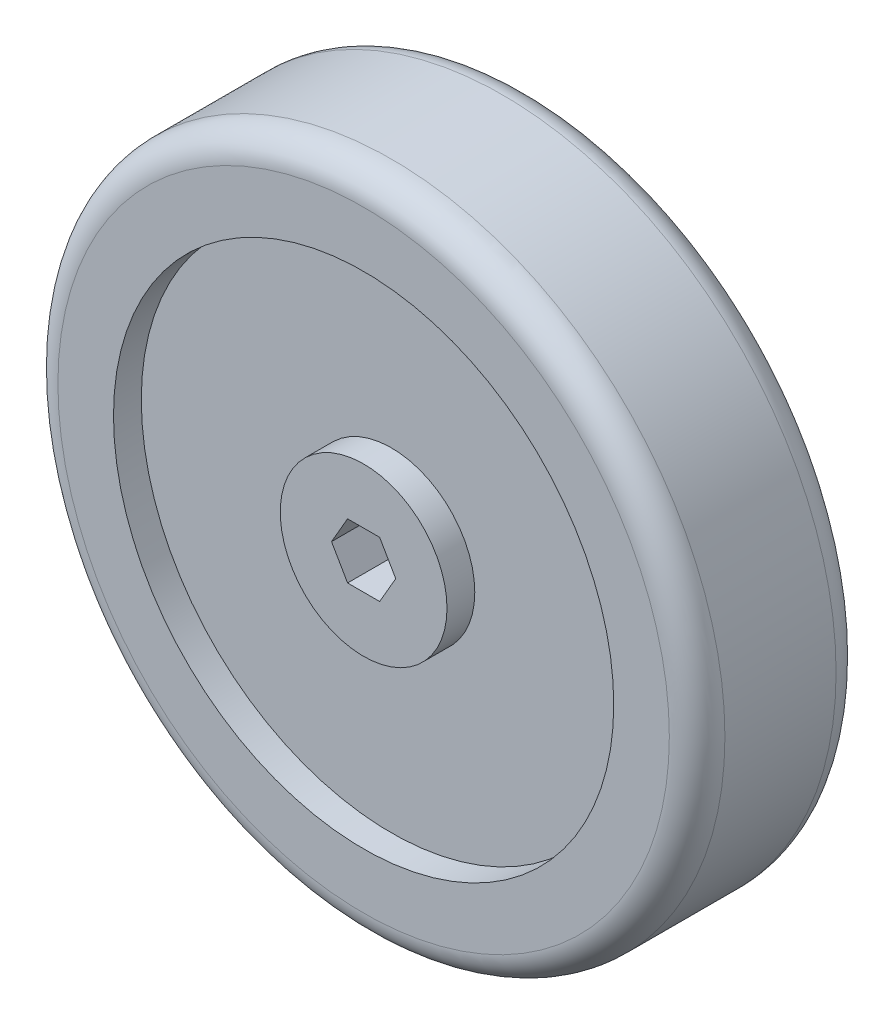
from build123d import *

# Parameters (mm, degrees)
SKETCH1_R           = 76.2
BOSS_EXTRUDE1_DEPTH = 38.1
FILLET1_R           = 6.35
CUT_EXTRUDE2_DEPTH  = 115.3
SKETCH3_R           = 57.15
SKETCH3_R_2         = 19.05
CUT_EXTRUDE3_DEPTH  = 6.35


with BuildPart() as part:
    # Sketch1 → Boss-Extrude1 (new body)
    with BuildSketch(Plane.XY):
        Circle(SKETCH1_R)
    extrude(amount=BOSS_EXTRUDE1_DEPTH)

    # Fillet1
    fillet1_edges = [part.edges().sort_by_distance(p)[0] for p in [
        (-76.2, 0, 0),
        (-76.2, 0, 38.1),
    ]]
    fillet(fillet1_edges, radius=FILLET1_R)

    # Sketch2 → Cut-Extrude2 (cut, through all)
    with BuildSketch(Plane.XY.offset(38.1)):
        Polygon((7.332348419, 0), (3.666174209, 6.35), (-3.666174209, 6.35), (-7.332348419, 0), (-3.666174209, -6.35), (3.666174209, -6.35), align=None)
    extrude(amount=-CUT_EXTRUDE2_DEPTH, mode=Mode.SUBTRACT)

    # Sketch3 → Cut-Extrude3 (cut)
    with BuildSketch(Plane.XY.offset(38.1)):
        Circle(SKETCH3_R)
        Circle(SKETCH3_R_2, mode=Mode.SUBTRACT)
    cut_extrude3 = extrude(amount=-CUT_EXTRUDE3_DEPTH, mode=Mode.SUBTRACT)

    # Mirror1: Cut-Extrude3 across plane
    add(cut_extrude3.mirror(Plane.XY.offset(19.05)), mode=Mode.SUBTRACT)


solid = part.part
